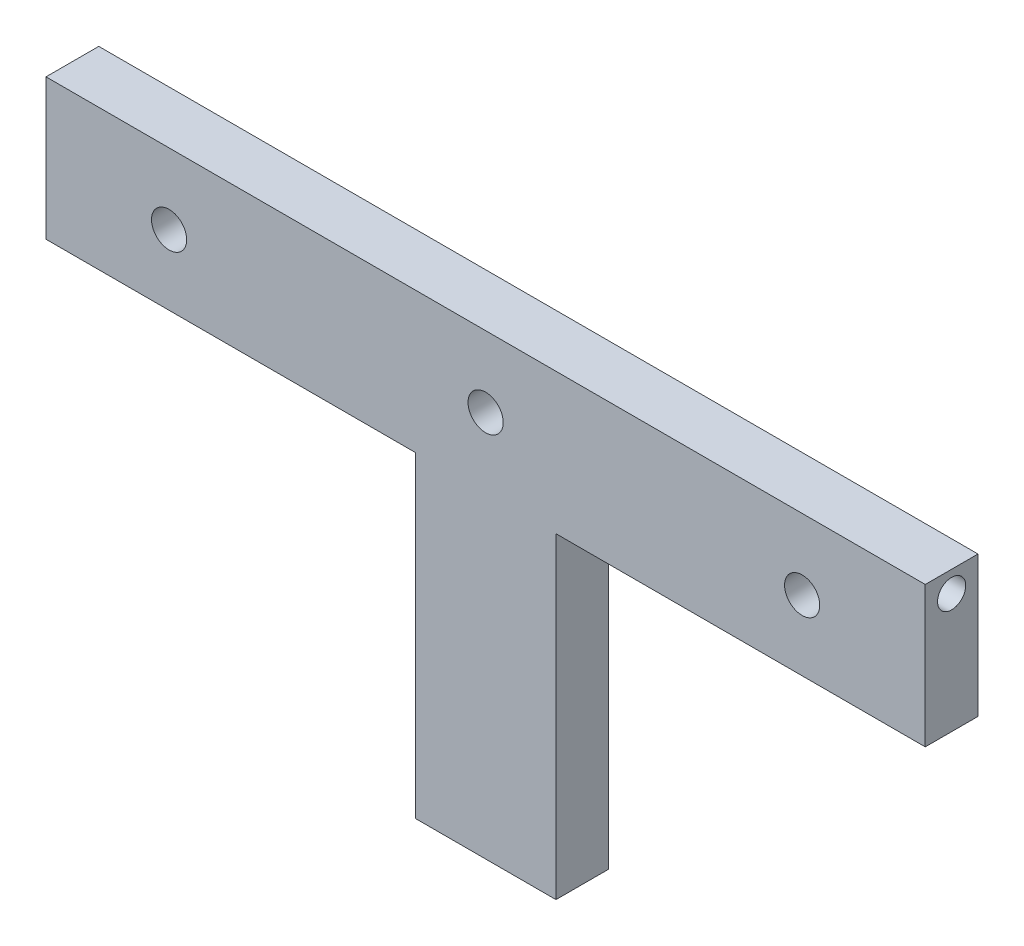
from build123d import *

# Parameters (mm, degrees)
EXTRUDE_1_DEPTH     = 15
SKETCH_2_R          = 5
CUT_EXTRUDE_1_DEPTH = 212.504412291
SKETCH_3_R          = 4
CUT_EXTRUDE_2_DEPTH = 286.629913017


with BuildPart() as part:
    # 草圖1 → 填料-伸長1 (new body)
    with BuildSketch(Plane.XY):
        Polygon((-15.155141061, 7.219614063), (-55.155141061, 7.219614063), (-55.155141061, 97.329702578), (-160.155141061, 97.329702578), (-160.155141061, 137.329702578), (89.844858939, 137.329702578), (89.844858939, 97.329702578), (-15.155141061, 97.329702578), align=None)
    extrude(amount=EXTRUDE_1_DEPTH)

    # 草圖2 → 除料-伸長1 (cut, through all)
    with BuildSketch(Plane.XY.offset(15)):
        with Locations((54.844858939, 117.189491535)):
            Circle(SKETCH_2_R)
        with Locations((-35.155141061, 117.189491535)):
            Circle(SKETCH_2_R)
        with Locations((-125.155141061, 117.189491535)):
            Circle(SKETCH_2_R)
    extrude(amount=-CUT_EXTRUDE_1_DEPTH, mode=Mode.SUBTRACT)

    # 草圖3 → 除料-伸長2 (cut, through all)
    with BuildSketch(Plane(origin=(89.844858939, 0, 0), x_dir=(0, 0, -1), z_dir=(1, 0, 0))):
        with Locations((-7.5, 131.329702578)):
            Circle(SKETCH_3_R)
    extrude(amount=-CUT_EXTRUDE_2_DEPTH, mode=Mode.SUBTRACT)


solid = part.part
